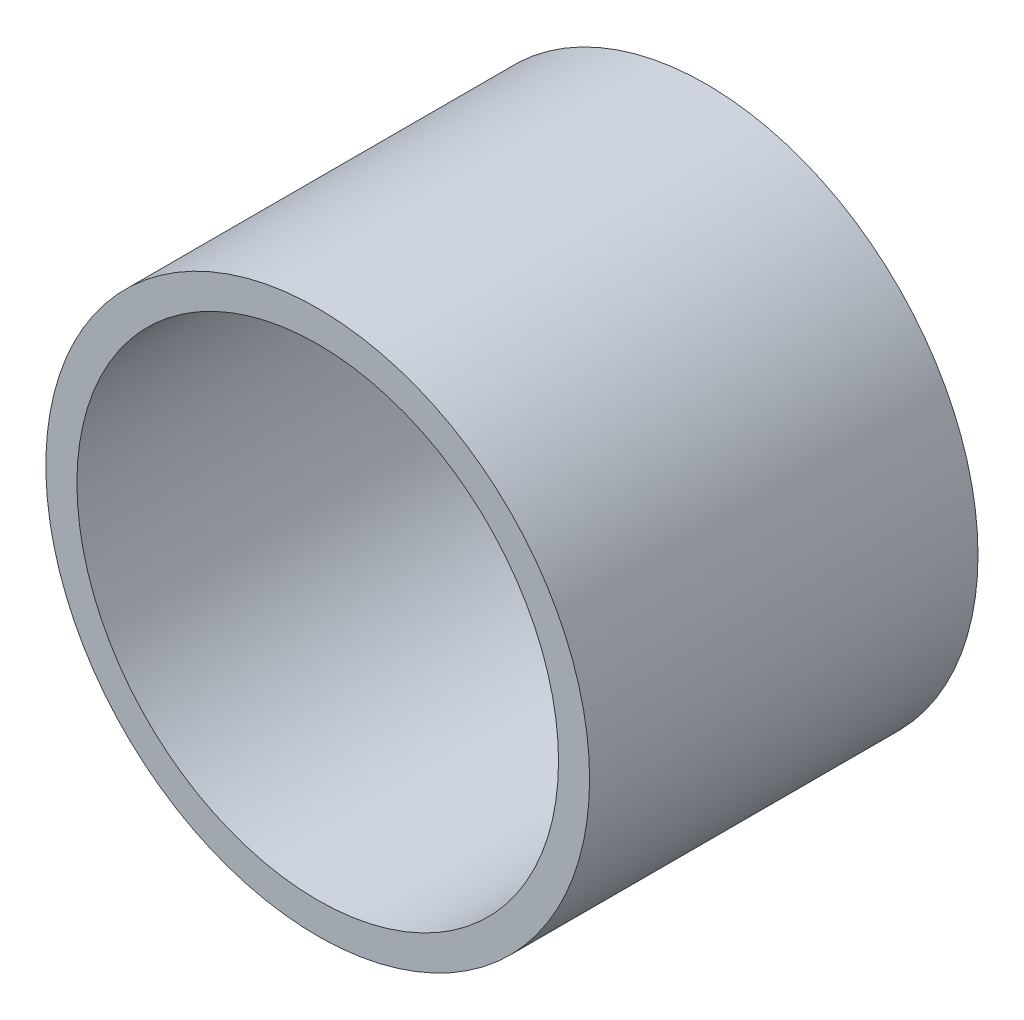
from build123d import *

# Parameters (mm, degrees)
SKETCH_1_R      = 3.5
SKETCH_1_R_2    = 3.1
EXTRUDE_1_DEPTH = 5


with BuildPart() as part:
    # Эскиз1 → Бобышка-Вытянуть1 (new body)
    with BuildSketch(Plane.XY):
        Circle(SKETCH_1_R)
        Circle(SKETCH_1_R_2, mode=Mode.SUBTRACT)
    extrude(amount=EXTRUDE_1_DEPTH)


solid = part.part
